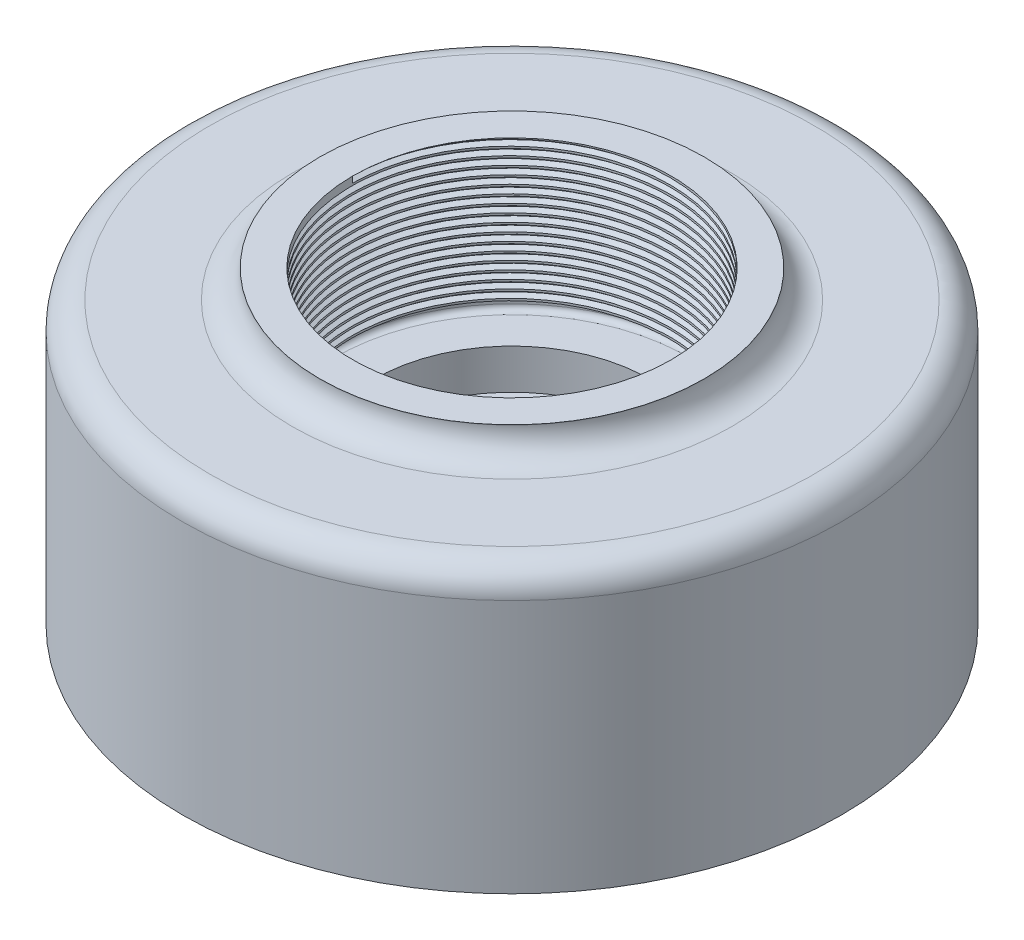
from build123d import *

# Parameters (mm, degrees)
THREAD1_PITCH = 1.5


with BuildPart() as part:
    # Sketch2 → Revolve1 (revolve)
    with BuildSketch(Plane.XY, mode=Mode.PRIVATE) as revolve1_sk:
        with BuildLine():
            Line((0, -15.796460177), (-60, -15.796460177))
            Line((-60, -15.796460177), (-60, 30.442477876))
            ThreePointArc((-60, 30.442477876), (-58.535533906, 33.978011782), (-55, 35.442477876))
            Line((-55, 35.442477876), (-40, 35.442477876))
            ThreePointArc((-40, 35.442477876), (-36.464466094, 36.90694397), (-35, 40.442477876))
            Line((-35, 40.442477876), (-35, 40.486725664))
            Line((-35, 40.486725664), (-29, 40.486725664))
            Line((-29, 40.486725664), (-29, 14.486725664))
            Line((-29, 14.486725664), (-32, 14.486725664))
            ThreePointArc((-32, 14.486725664), (-32.707106781, 14.193832445), (-33, 13.486725664))
            Line((-33, 13.486725664), (-33, 11.486725664))
            ThreePointArc((-33, 11.486725664), (-32.707106781, 10.779618883), (-32, 10.486725664))
            Line((-32, 10.486725664), (-29, 10.486725664))
            Line((-29, 10.486725664), (-25, 10.486725664))
            Line((-25, 10.486725664), (-25, 3.203539823))
            Line((-25, 3.203539823), (0, 3.203539823))
            Line((0, 3.203539823), (0, -15.796460177))
        make_face()
    revolve(revolve1_sk.sketch.rotate(Axis((0, 81.902654867, 0), (0, -1, 0)), 270), axis=Axis((0, 81.902654867, 0), (0, -1, 0)))

    # Thread1: the profile of Thread Profile1 profile screwed along a right-hand helix of 20 turns, 8 arcs to a turn; built about Z, then put on its axis
    thread1_z = Axis((0, 0, 0), (0, 0, 1))
    thread1_corners = [(28.9997, 0, -0.000173205), (29.811898813, 0, 0.468749998), (29.811898813, 0, 0.656249998), (28.9997, 0, 1.125173201)]
    with BuildLine(mode=Mode.PRIVATE) as thread1_profile:
        Line(thread1_corners[0], thread1_corners[1])
        Line(thread1_corners[1], thread1_corners[2])
        Line(thread1_corners[2], thread1_corners[3])
        Line(thread1_corners[3], thread1_corners[0])
    thread1_cap = Face(thread1_profile.wire())
    thread1_turn_angles = [0, 22.5, 45, 67.5, 90, 112.5, 135, 157.5, 180, 202.5, 225, 247.5, 270, 292.5, 315, 337.5, 360]
    thread1_turn_weights = [1, 0.9238795325112867, 1, 0.9238795325112867, 1, 0.9238795325112867, 1, 0.9238795325112867, 1, 0.9238795325112867, 1, 0.9238795325112867, 1, 0.9238795325112867, 1, 0.9238795325112867, 1]
    thread1_turn_rails = [Edge.make_bspline([Vector(p[0], p[1], 0).rotate(thread1_z, thread1_turn_angles[k]) / thread1_turn_weights[k] + Vector(0, 0, p[2] + THREAD1_PITCH * thread1_turn_angles[k] / 360) for k in range(17)], [0, 0, 0, 1, 1, 2, 2, 3, 3, 4, 4, 5, 5, 6, 6, 7, 7, 8, 8, 8], 2, thread1_turn_weights) for p in thread1_corners]
    thread1_turn_sides = [Face.make_surface_from_curves(thread1_turn_rails[p[0]], thread1_turn_rails[p[1]]) for p in [(0, 1), (1, 2), (2, 3), (3, 0)]]
    thread1 = Plane(origin=(0, 40.486725664, 0), x_dir=(-1, 0, 0), z_dir=(0, -1, 0)) * Solid(Shell([*[p.moved(Location((0, 0, THREAD1_PITCH * i))) for i in range(20) for p in thread1_turn_sides], thread1_cap, thread1_cap.rotate(thread1_z, 7200).moved(Location((0, 0, THREAD1_PITCH * 7200 / 360)))]))
    add(thread1, mode=Mode.SUBTRACT)


solid = part.part
